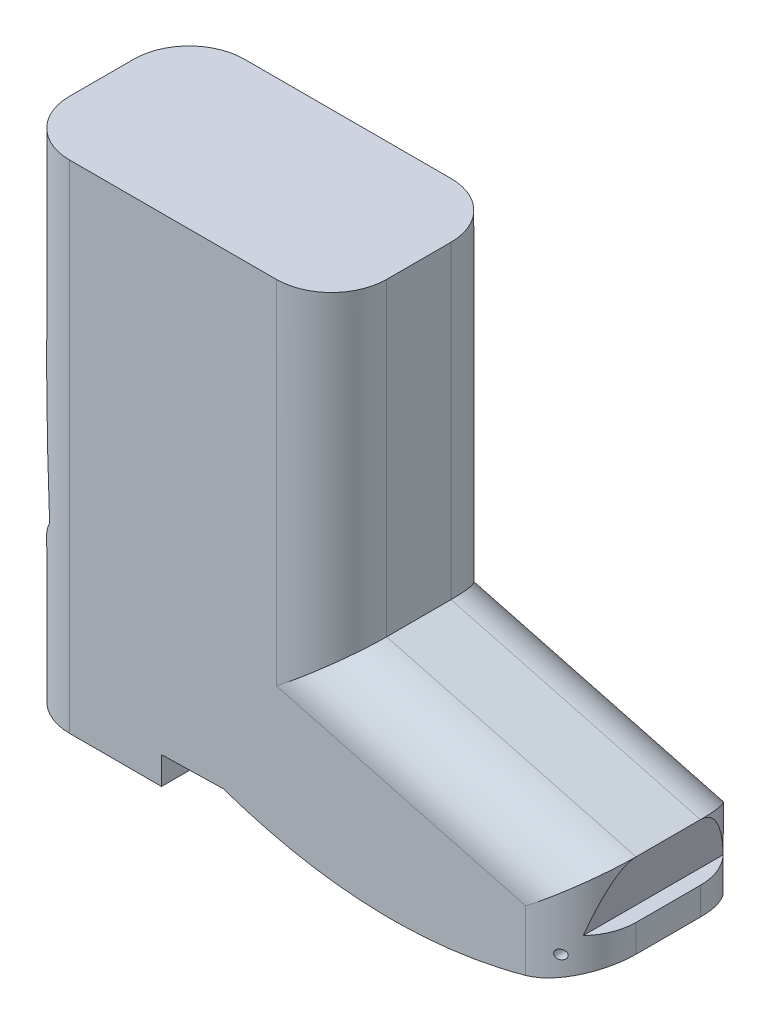
from build123d import *

# Parameters (mm, degrees)
SKETCH1_W               = 308
SKETCH1_H               = 95
BOSS_EXTRUDE1_DEPTH     = 270
FILLET1_R               = 30
SKETCH2_OUTSIDE_W       = 394.092
SKETCH2_OUTSIDE_H       = 356.092
CUT_EXTRUDE1_DEPTH      = 421.462840213
FILLET2_R               = 30
CUT_EXTRUDE2_DEPTH      = 413.33511864
CUT_EXTRUDE2_DEPTH_BACK = 413.33511864
SKETCH3_R               = 2.5


with BuildPart() as part:
    # Sketch1 → Boss-Extrude1 (new body)
    with BuildSketch(Plane(origin=(0, 0, 0), x_dir=(1, 0, 0), z_dir=(0, 1, 0))):
        with Locations((-154, 0)):
            Rectangle(SKETCH1_W, SKETCH1_H)
    extrude(amount=BOSS_EXTRUDE1_DEPTH)

    # Fillet1
    fillet1_edges = [part.edges().sort_by_distance(p)[0] for p in [
        (-308, 135, -47.5),
        (0, 135, -47.5),
        (0, 135, 47.5),
        (-308, 135, 47.5),
    ]]
    fillet(fillet1_edges, radius=FILLET1_R)

    # Sketch2 outside → Cut-Extrude1 (cut, through all)
    with BuildSketch(Plane.XY.offset(47.5)):
        with Locations((-154, 135)):
            Rectangle(SKETCH2_OUTSIDE_W, SKETCH2_OUTSIDE_H)
        with BuildLine():
            Line((-228, 0), (-228, 15))
            add(Edge.make_bspline(
                [(-228, 15), (-211.229646979, 15.3677709), (-194.459293959, 15.735541799)],
                knots=[0, 0, 0, 0.14710836, 0.14710836, 0.14710836], degree=2))
            add(Edge.make_bspline(
                [(-194.459293959, 15.735541799), (-97.174631898, -17.834493168), (0, 20)],
                knots=[0, 0, 0, 1, 1, 1], degree=2))
            Line((0, 20), (0, 35))
            Line((0, 35), (-8.156845185, 35))
            Line((-8.156845185, 35), (0, 65.897747125))
            Line((0, 65.897747125), (-135.594672757, 101.694038328))
            Line((-135.594672757, 101.694038328), (-135.594672757, 270))
            Line((-135.594672757, 270), (-310, 270))
            Line((-310, 270), (-292.695445045, 89.818838494))
            Line((-292.695445045, 89.818838494), (-308, 65.708414359))
            Line((-308, 65.708414359), (-308, 0))
            Line((-308, 0), (-228, 0))
        make_face(mode=Mode.SUBTRACT)
    extrude(amount=-CUT_EXTRUDE1_DEPTH, mode=Mode.SUBTRACT)

    # Fillet2
    # the kernel refuses this fillet: 30 mm, written as the material it takes off along each edge
    with BuildSketch(Plane(origin=(-208.110304148, 120.83778937, -47.5), x_dir=(-0.2552500139062178, -0.9668750852105331, 0), z_dir=(0.9668750852105331, -0.2552500139062178, 0))) as fillet2_piece_1_section:
        with BuildLine():
            CenterArc((FILLET2_R, -FILLET2_R), FILLET2_R, 90, 90)
            Line((0, -FILLET2_R), (0, 0))
            Line((0, 0), (FILLET2_R, 0))
        make_face()
    fillet2_piece_1 = extrude(amount=259.212321604, mode=Mode.PRIVATE)
    fillet2_piece_1 = split(fillet2_piece_1, bisect_by=Plane(origin=(-135.594672757, 71.448800887, -40.672385081), z_dir=(1, 0, 0)), keep=Keep.TOP, mode=Mode.PRIVATE)
    add(fillet2_piece_1, mode=Mode.SUBTRACT)
    with BuildSketch(Plane(origin=(42.515631391, 54.673840676, 47.5), x_dir=(0, 0, -1), z_dir=(-0.9668750852105331, 0.2552500139062178, 0))) as fillet2_piece_2_section:
        with BuildLine():
            CenterArc((FILLET2_R, FILLET2_R), FILLET2_R, 180, 90)
            Line((0, FILLET2_R), (0, 0))
            Line((0, 0), (FILLET2_R, 0))
        make_face()
    fillet2_piece_2 = extrude(amount=259.212321604, mode=Mode.PRIVATE)
    fillet2_piece_2 = split(fillet2_piece_2, bisect_by=Plane(origin=(-135.594672757, 71.448800887, 40.672385081), z_dir=(1, 0, 0)), keep=Keep.TOP, mode=Mode.PRIVATE)
    add(fillet2_piece_2, mode=Mode.SUBTRACT)
    with BuildSketch(Plane(origin=(-135.594672757, 345, -47.5), x_dir=(-1, 0, 0), z_dir=(0, -1, 0))) as fillet2_piece_3_section:
        with BuildLine():
            CenterArc((FILLET2_R, -FILLET2_R), FILLET2_R, 90, 90)
            Line((0, -FILLET2_R), (0, 0))
            Line((0, 0), (FILLET2_R, 0))
        make_face()
    fillet2_piece_3 = extrude(amount=318.305961672, mode=Mode.PRIVATE)
    fillet2_piece_3 = split(fillet2_piece_3, bisect_by=Plane(origin=(-172.144372256, 111.342969661, -40.68113524), z_dir=(0.2552500139062178, 0.9668750852105331, 0)), keep=Keep.TOP, mode=Mode.PRIVATE)
    add(fillet2_piece_3, mode=Mode.SUBTRACT)
    with BuildSketch(Plane(origin=(-135.594672757, 26.694038328, 47.5), x_dir=(0, 0, -1), z_dir=(0, 1, 0))) as fillet2_piece_4_section:
        with BuildLine():
            CenterArc((FILLET2_R, FILLET2_R), FILLET2_R, 180, 90)
            Line((0, FILLET2_R), (0, 0))
            Line((0, 0), (FILLET2_R, 0))
        make_face()
    fillet2_piece_4 = extrude(amount=318.305961672, mode=Mode.PRIVATE)
    fillet2_piece_4 = split(fillet2_piece_4, bisect_by=Plane(origin=(-172.144372256, 111.342969661, 40.68113524), z_dir=(0.2552500139062178, 0.9668750852105331, 0)), keep=Keep.TOP, mode=Mode.PRIVATE)
    add(fillet2_piece_4, mode=Mode.SUBTRACT)
    with BuildSketch(Plane(origin=(-208.110304148, 120.83778937, -47.5), x_dir=(-0.2552500139062178, -0.9668750852105331, 0), z_dir=(0.9668750852105331, -0.2552500139062178, 0))) as fillet2_piece_5a_section:
        with BuildLine():
            CenterArc((FILLET2_R, -FILLET2_R), FILLET2_R, 90, 90)
            Line((0, -FILLET2_R), (0, 0))
            Line((0, 0), (FILLET2_R, 0))
        make_face()
    fillet2_piece_5a = extrude(amount=259.212321604, mode=Mode.PRIVATE)
    fillet2_piece_5a = split(fillet2_piece_5a, bisect_by=Plane(origin=(-135.594672757, 104.326327601, -40.79309683), z_dir=(-1, 0, 0)), keep=Keep.TOP, mode=Mode.PRIVATE)
    with BuildSketch(Plane(origin=(-135.594672757, 345, -47.5), x_dir=(-1, 0, 0), z_dir=(0, -1, 0))) as fillet2_piece_5b_section:
        with BuildLine():
            CenterArc((FILLET2_R, -FILLET2_R), FILLET2_R, 90, 90)
            Line((0, -FILLET2_R), (0, 0))
            Line((0, 0), (FILLET2_R, 0))
        make_face()
    fillet2_piece_5b = extrude(amount=318.305961672, mode=Mode.PRIVATE)
    fillet2_piece_5b = split(fillet2_piece_5b, bisect_by=Plane(origin=(-133.049577842, 101.022146454, -40.79309683), z_dir=(-0.2552500139062178, -0.9668750852105331, 0)), keep=Keep.TOP, mode=Mode.PRIVATE)
    fillet2_piece_5 = fillet2_piece_5a & fillet2_piece_5b
    add(fillet2_piece_5, mode=Mode.SUBTRACT)
    with BuildSketch(Plane(origin=(42.515631391, 54.673840676, 47.5), x_dir=(0, 0, -1), z_dir=(-0.9668750852105331, 0.2552500139062178, 0))) as fillet2_piece_6a_section:
        with BuildLine():
            CenterArc((FILLET2_R, FILLET2_R), FILLET2_R, 180, 90)
            Line((0, FILLET2_R), (0, 0))
            Line((0, 0), (FILLET2_R, 0))
        make_face()
    fillet2_piece_6a = extrude(amount=259.212321604, mode=Mode.PRIVATE)
    fillet2_piece_6a = split(fillet2_piece_6a, bisect_by=Plane(origin=(-135.594672757, 104.326327601, 40.79309683), z_dir=(-1, 0, 0)), keep=Keep.TOP, mode=Mode.PRIVATE)
    with BuildSketch(Plane(origin=(-135.594672757, 26.694038328, 47.5), x_dir=(0, 0, -1), z_dir=(0, 1, 0))) as fillet2_piece_6b_section:
        with BuildLine():
            CenterArc((FILLET2_R, FILLET2_R), FILLET2_R, 180, 90)
            Line((0, FILLET2_R), (0, 0))
            Line((0, 0), (FILLET2_R, 0))
        make_face()
    fillet2_piece_6b = extrude(amount=318.305961672, mode=Mode.PRIVATE)
    fillet2_piece_6b = split(fillet2_piece_6b, bisect_by=Plane(origin=(-133.049577842, 101.022146454, 40.79309683), z_dir=(-0.2552500139062178, -0.9668750852105331, 0)), keep=Keep.TOP, mode=Mode.PRIVATE)
    fillet2_piece_6 = fillet2_piece_6a & fillet2_piece_6b
    add(fillet2_piece_6, mode=Mode.SUBTRACT)

    # Sketch3 → Cut-Extrude2 (cut, two sides: drawn at the far end of the back side and taken through both)
    with BuildSketch(Plane.XY.offset(-CUT_EXTRUDE2_DEPTH_BACK)):
        with Locations((-15, 25.4)):
            Circle(SKETCH3_R)
    extrude(amount=CUT_EXTRUDE2_DEPTH + CUT_EXTRUDE2_DEPTH_BACK, mode=Mode.SUBTRACT)


solid = part.part
